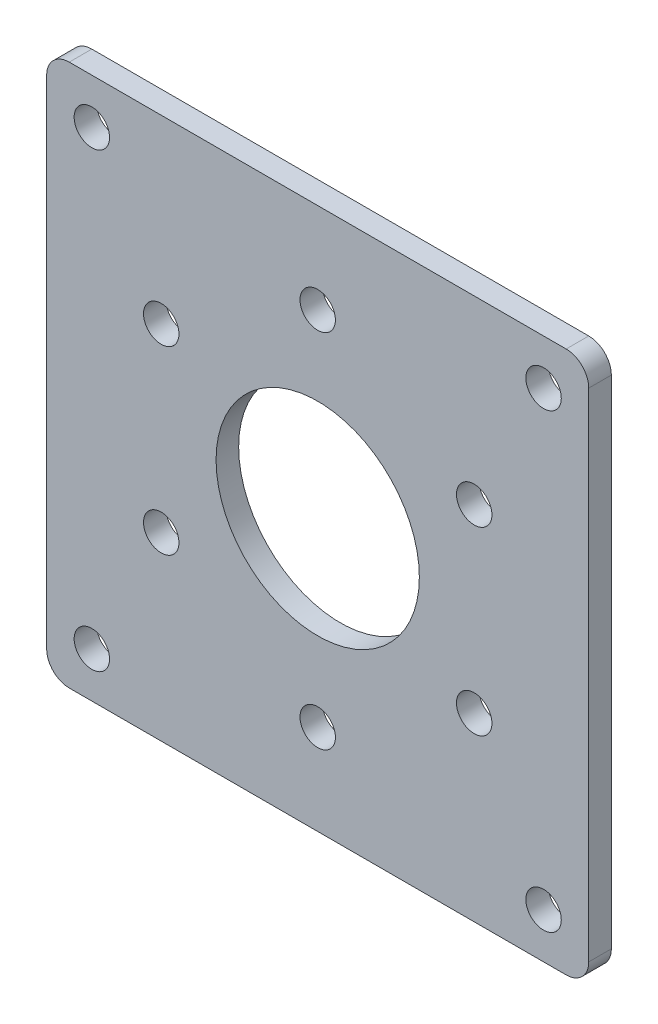
from build123d import *

# Parameters (mm, degrees)
SKETCH1_W           = 76.2
SKETCH1_H           = 76.2
SKETCH1_R           = 2.4892
SKETCH1_R_2         = 14.2875
BOSS_EXTRUDE1_DEPTH = 3.175
FILLET1_R           = 3.175


with BuildPart() as part:
    # Sketch1 → Boss-Extrude1 (new body)
    with BuildSketch(Plane.XY):
        Rectangle(SKETCH1_W, SKETCH1_H)
        with Locations((-31.75, -31.75)):
            Circle(SKETCH1_R, mode=Mode.SUBTRACT)
        with Locations((31.75, -31.75)):
            Circle(SKETCH1_R, mode=Mode.SUBTRACT)
        with Locations((-31.75, 31.75)):
            Circle(SKETCH1_R, mode=Mode.SUBTRACT)
        with Locations((31.75, 31.75)):
            Circle(SKETCH1_R, mode=Mode.SUBTRACT)
        with Locations((0, 25.4)):
            Circle(SKETCH1_R, mode=Mode.SUBTRACT)
        with Locations((-21.997045256, -12.7)):
            Circle(SKETCH1_R, mode=Mode.SUBTRACT)
        with Locations((0, -25.4)):
            Circle(SKETCH1_R, mode=Mode.SUBTRACT)
        Circle(SKETCH1_R_2, mode=Mode.SUBTRACT)
        with Locations((21.997045256, -12.7)):
            Circle(SKETCH1_R, mode=Mode.SUBTRACT)
        with Locations((-21.997045256, 12.7)):
            Circle(SKETCH1_R, mode=Mode.SUBTRACT)
        with Locations((21.997045256, 12.7)):
            Circle(SKETCH1_R, mode=Mode.SUBTRACT)
    extrude(amount=BOSS_EXTRUDE1_DEPTH)

    # Fillet1
    fillet1_edges = [part.edges().sort_by_distance(p)[0] for p in [
        (-38.1, -38.1, 1.5875),
        (38.1, 38.1, 1.5875),
        (38.1, -38.1, 1.5875),
        (-38.1, 38.1, 1.5875),
    ]]
    fillet(fillet1_edges, radius=FILLET1_R)


solid = part.part
